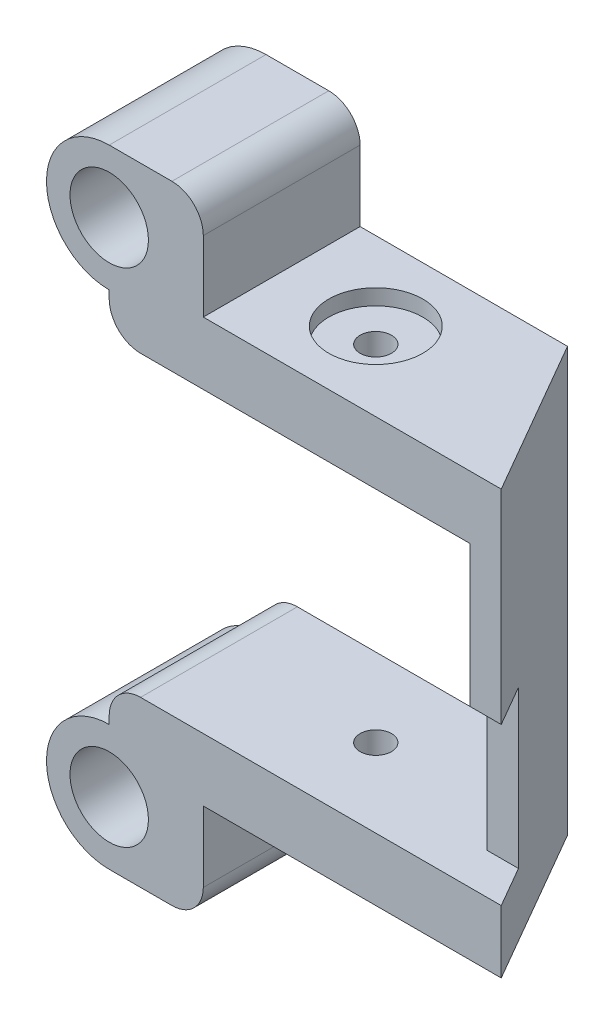
from build123d import *

# Parameters (mm, degrees)
CROQUIS1_R                = 2.5
SALIENTE_EXTRUIR1_DEPTH   = 10
CROQUIS2_R                = 1
CORTAR_EXTRUIR1_DEPTH     = 4
SALIENTE_EXTRUIR2_DEPTH   = 13.5
CROQUIS4_R                = 3
CORTAR_EXTRUIR2_DEPTH     = 1
REDONDEO1_R               = 2
CORTAR_EXTRUIR3_START     = -2.598076211
CORTAR_EXTRUIR3_OUTLINE_W = 6
CORTAR_EXTRUIR3_OUTLINE_H = 10
CORTAR_EXTRUIR3_DEPTH     = 2.598076211


# Read off the part's stored shape, not the designer's step: Cortar-Extruir3
with BuildPart() as part:
    # Croquis1 → Saliente-Extruir1 (new body)
    with BuildSketch(Plane.XY):
        with BuildLine():
            Line((-106.231635218, 22.700651543), (-131.231635218, 22.700651543))
            Line((-131.231635218, 22.700651543), (-131.231635218, 20.200651543))
            ThreePointArc((-131.231635218, 20.200651543), (-135.231635218, 16.200651543), (-131.231635218, 12.200651543))
            Line((-131.231635218, 12.200651543), (-125.231635218, 12.200651543))
            Line((-125.231635218, 12.200651543), (-125.231635218, 18.700651543))
            Line((-125.231635218, 18.700651543), (-106.231635218, 18.700651543))
            Line((-106.231635218, 18.700651543), (-106.231635218, 22.700651543))
        make_face()
        with Locations((-131.231635218, 16.200651543)):
            Circle(CROQUIS1_R, mode=Mode.SUBTRACT)
    extrude(amount=SALIENTE_EXTRUIR1_DEPTH)

    # Croquis2 → Cortar-Extruir1 (cut)
    with BuildSketch(Plane.XZ.offset(-18.700651543)):
        with Locations(Location((-119.231635218, 5, 0), (0, 0, 270))):
            Circle(CROQUIS2_R)
        Polygon((-106.231635218, 0), (-106.231635218, 10), (-112.00513791, 0), align=None)
    extrude(amount=-CORTAR_EXTRUIR1_DEPTH, mode=Mode.SUBTRACT)

    # Croquis3 → Saliente-Extruir2 (add)
    with BuildSketch(Plane.XZ.offset(-18.700651543)):
        Polygon((-106.231635218, 10), (-108.231635218, 10), (-114.00513791, 0), (-112.00513791, 0), align=None)
    extrude(amount=-SALIENTE_EXTRUIR2_DEPTH)

    # Croquis4 → Cortar-Extruir2 (cut)
    with BuildSketch(Plane.XZ.offset(-18.700651543)):
        with Locations(Location((-119.231635218, 5, 0), (0, 0, 270))):
            Circle(CROQUIS4_R)
    extrude(amount=-CORTAR_EXTRUIR2_DEPTH, mode=Mode.SUBTRACT)

    # Redondeo1
    redondeo1_edges = [part.edges().sort_by_distance(p)[0] for p in [
        (-125.231635218, 12.200651543, 5),
        (-131.231635218, 22.700651543, 5),
    ]]
    fillet(redondeo1_edges, radius=REDONDEO1_R)

    # Simetría1: part across plane


with BuildPart() as part_1:
    add(part.part)
    add(part.part.mirror(Plane(origin=(0, 32.200651543, 0), x_dir=(0, 0, 1), z_dir=(0, -1, 0))))

    # Cortar-Extruir3 outline → Cortar-Extruir3 (cut)
    with BuildSketch(Plane.XY.offset(10).offset(CORTAR_EXTRUIR3_START)):
        with Locations((-108, 27.700651543)):
            Rectangle(CORTAR_EXTRUIR3_OUTLINE_W, CORTAR_EXTRUIR3_OUTLINE_H)
    extrude(amount=CORTAR_EXTRUIR3_DEPTH, mode=Mode.SUBTRACT)


solid = part_1.part
